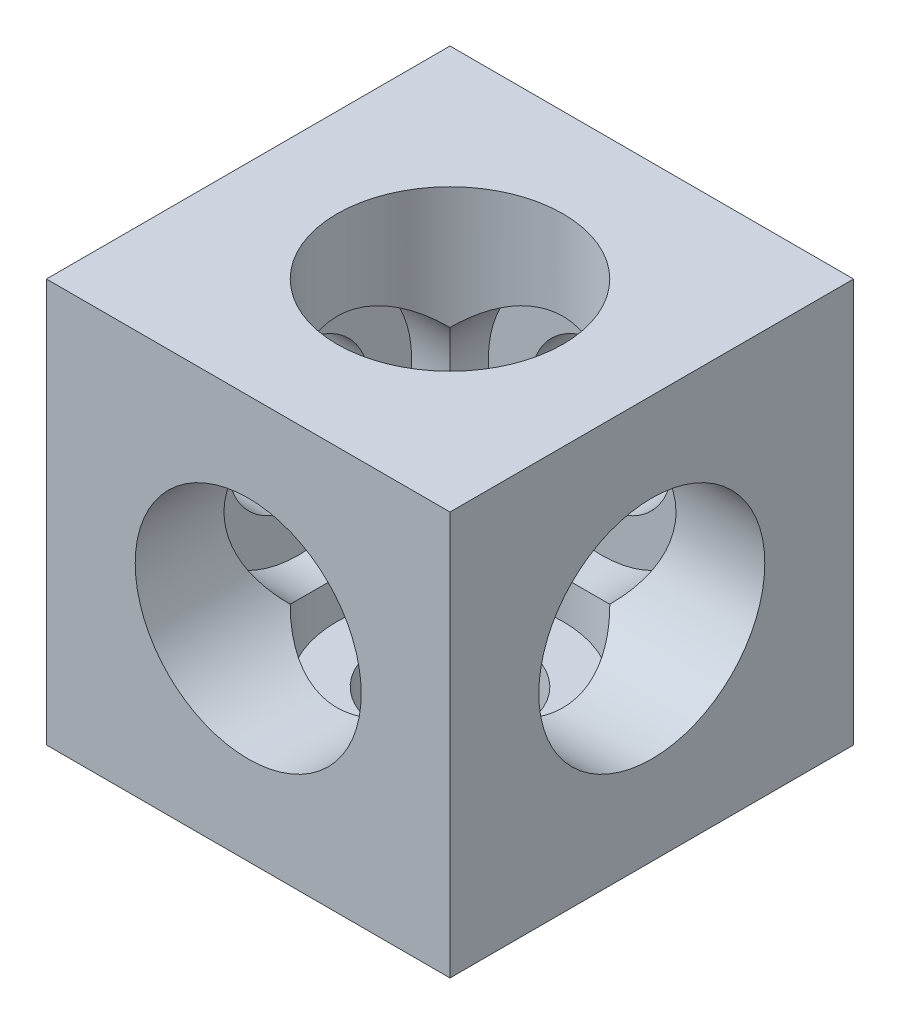
from build123d import *

# Parameters (mm, degrees)
SKETCH1_W           = 20
SKETCH1_H           = 20
BOSS_EXTRUDE1_DEPTH = 20
HOLE1_D             = 7
HOLE1_CBORE_D       = 11.2
HOLE1_CBORE_DEPTH   = 17.5
HOLE2_D             = 7
HOLE2_CBORE_D       = 11.2
HOLE2_CBORE_DEPTH   = 17.5


with BuildPart() as part:
    # Sketch1 → Boss-Extrude1 (new body)
    with BuildSketch(Plane(origin=(0, 10, 0), x_dir=(1, 0, 0), z_dir=(0, 1, 0))):
        Rectangle(SKETCH1_W, SKETCH1_H)
    extrude(amount=-BOSS_EXTRUDE1_DEPTH)

    # Sketch2 → Cut-Revolve1 (revolve, cut)
    with BuildSketch(Plane(origin=(0, 0, 0), x_dir=(-1, 0, 0), z_dir=(0, 0, -1))):
        Polygon((-3.5, -10), (0, -10), (0, 10), (-5.6, 10), (-5.6, -7.5), (-3.5, -7.5), align=None)
    revolve(axis=Axis((0, -10, 0), (0, 1, 0)), mode=Mode.SUBTRACT)

    # Hole1 (through all)
    with Locations(Plane.XY.offset(10)):
        with Locations((0, 0)):
            CounterBoreHole(HOLE1_D / 2, HOLE1_CBORE_D / 2, HOLE1_CBORE_DEPTH)

    # Hole2 (through all)
    with Locations(Plane(origin=(10, 0, 0), x_dir=(0, 0, -1), z_dir=(1, 0, 0))):
        with Locations((0, 0)):
            CounterBoreHole(HOLE2_D / 2, HOLE2_CBORE_D / 2, HOLE2_CBORE_DEPTH)


solid = part.part
